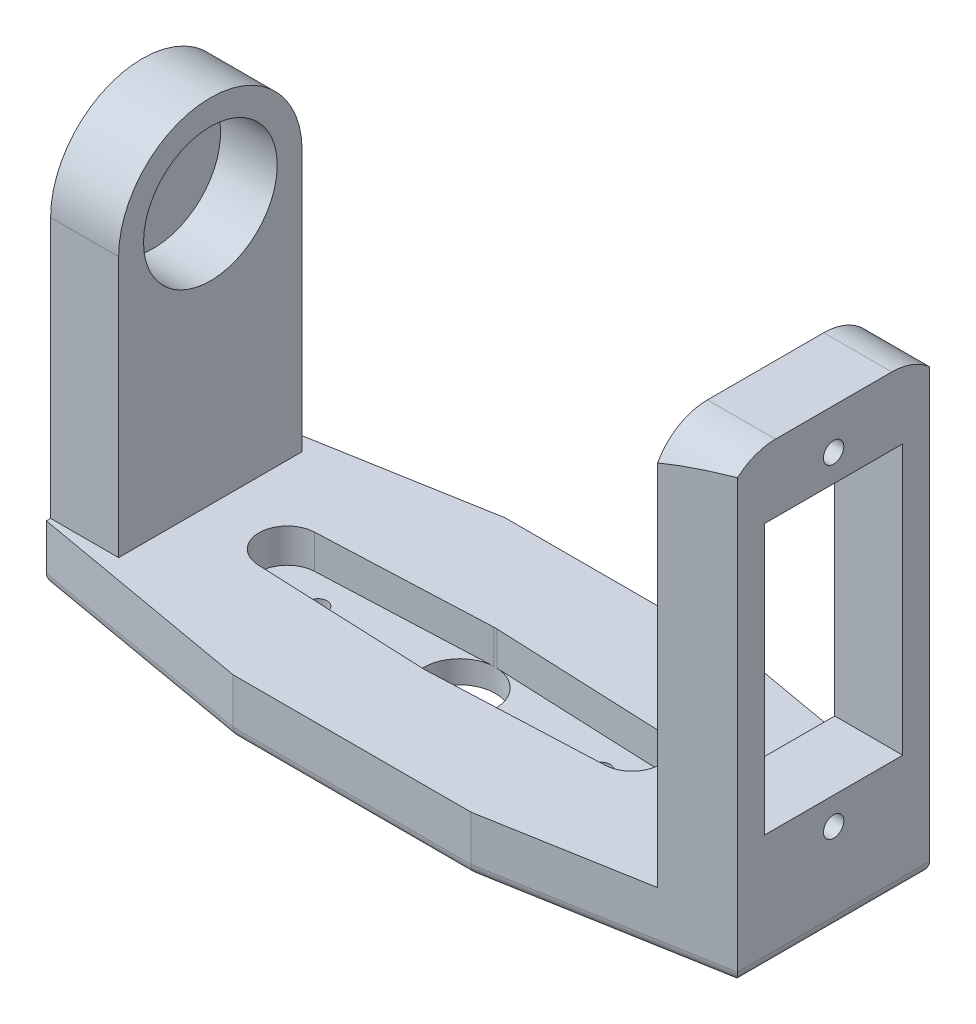
from build123d import *

# Parameters (mm, degrees)
SKETCH_1_W          = 61
SKETCH_1_H          = 24
EXTRUDE_1_DEPTH     = 5
SKETCH_2_W          = 16.198202564
SKETCH_2_H          = 31.099101282
SKETCH_2_R          = 5.9
EXTRUDE_2_DEPTH     = 6
SKETCH_8_R          = 5.9
EXTRUDE_4_DEPTH     = 1
FILLET_1_RADIUS     = 8.099101282
FILLET_1_LENGTH     = 6
SKETCH_3_W          = 20.26798367
SKETCH_3_H          = 35.075185683
SKETCH_3_R          = 0.9
SKETCH_3_W_2        = 12.2
SKETCH_3_H_2        = 23.8
EXTRUDE_3_DEPTH     = 6
FILLET_2_R          = 5
CHAMFER_1_SIZE      = 3.526539614
CHAMFER_1_SIZE_2    = 20
FILLET_4_R          = 1
CUT_EXTRUDE_1_DEPTH = 3
SKETCH_5_R          = 3.15
SKETCH_5_R_2        = 0.8
CUT_EXTRUDE_2_DEPTH = 2.4


with BuildPart() as part:
    # 草图1 → 凸台-拉伸1 (new body)
    with BuildSketch(Plane(origin=(0, 0, 0), x_dir=(1, 0, 0), z_dir=(0, 1, 0))):
        with Locations((2.5, 0)):
            Rectangle(SKETCH_1_W, SKETCH_1_H)
    extrude(amount=EXTRUDE_1_DEPTH)

    # 草图2 → 凸台-拉伸2 (add)
    with BuildSketch(Plane.ZY.offset(28)):
        with Locations((0, 20.549550641)):
            Rectangle(SKETCH_2_W, SKETCH_2_H)
        with Locations((0, 28)):
            Circle(SKETCH_2_R, mode=Mode.SUBTRACT)
    extrude(amount=-EXTRUDE_2_DEPTH)

    # 草图8 → 凸台-拉伸4 (add)
    with BuildSketch(Plane.ZY.offset(28)):
        with Locations((0, 28)):
            Circle(SKETCH_8_R)
    extrude(amount=-EXTRUDE_4_DEPTH)

    # 圆角1: full round fillet: the end face becomes a half cylinder, R = half its width
    fillet_1_face = Plane((-25, 36.099101282, 0), x_dir=(-1, 0, 0), z_dir=(0, 1, 0))  # on the end face: x along it, z out of the body
    fillet_1_slab = fillet_1_face.offset(-FILLET_1_RADIUS / 2) * Box(FILLET_1_LENGTH, 2 * FILLET_1_RADIUS, FILLET_1_RADIUS, mode=Mode.PRIVATE)  # the body's end, R deep
    fillet_1_round = Plane((-25, 28, 0), x_dir=(0, 1, 0), z_dir=(-1, 0, 0)) * Cylinder(FILLET_1_RADIUS, FILLET_1_LENGTH, mode=Mode.PRIVATE)  # its axis R under the face
    add(fillet_1_slab - fillet_1_round, mode=Mode.SUBTRACT)

    # 草图3 → 凸台-拉伸3 (add)
    with BuildSketch(Plane(origin=(33, 0, 0), x_dir=(0, 0, -1), z_dir=(1, 0, 0))):
        with Locations((0, 22.537592842)):
            Rectangle(SKETCH_3_W, SKETCH_3_H)
        with Locations((0, 7.9)):
            Circle(SKETCH_3_R, mode=Mode.SUBTRACT)
        with Locations(Location((0, 36.5, 0), (0, 0, 180))):
            Circle(SKETCH_3_R, mode=Mode.SUBTRACT)
        with Locations((0, 22.2)):
            Rectangle(SKETCH_3_W_2, SKETCH_3_H_2, mode=Mode.SUBTRACT)
    extrude(amount=-EXTRUDE_3_DEPTH)

    # 圆角2
    fillet_2_edges = [part.edges().sort_by_distance(p)[0] for p in [
        (30, 40.075185683, 10.133991835),
        (30, 40.075185683, -10.133991835),
    ]]
    fillet(fillet_2_edges, radius=FILLET_2_R)

    # 倒角1
    # the kernel refuses this chamfer: 20, 3.526539614 mm, written as the material it takes off along each edge
    with BuildSketch(Plane(origin=(33, -51.970775928, -12), x_dir=(0.21013876076743143, 0, 0.9776715712462587), z_dir=(0, 1, 0))) as chamfer_1_piece_1:
        Polygon((CHAMFER_1_SIZE * 0.977671571293, -CHAMFER_1_SIZE * 0.210138760778), (-CHAMFER_1_SIZE_2 * 0.210138760767, -CHAMFER_1_SIZE_2 * 0.977671571246), (0, 0), align=None)
    extrude(amount=108.941551857, mode=Mode.SUBTRACT)
    with BuildSketch(Plane(origin=(-28, -51.970775928, -12), x_dir=(0.9999776716360547, 0, -0.006682531656102014), z_dir=(0, 1, 0))) as chamfer_1_piece_2:
        Polygon((CHAMFER_1_SIZE_2 * 0.999977671636, -CHAMFER_1_SIZE_2 * 0.0066825316561), (-CHAMFER_1_SIZE * 0.00668253165642, -CHAMFER_1_SIZE * 0.999977671684), (0, 0), align=None)
    extrude(amount=108.941551857, mode=Mode.SUBTRACT)
    with BuildSketch(Plane(origin=(33, -51.970775928, 12), x_dir=(0.21013876076743124, 0, -0.9776715712462587), z_dir=(0, 1, 0))) as chamfer_1_piece_3:
        Polygon((CHAMFER_1_SIZE * 0.977671571293, CHAMFER_1_SIZE * 0.210138760778), (-CHAMFER_1_SIZE_2 * 0.210138760767, CHAMFER_1_SIZE_2 * 0.977671571246), (0, 0), align=None)
    extrude(amount=108.941551857, mode=Mode.SUBTRACT)
    with BuildSketch(Plane(origin=(-28, -51.970775928, 12), x_dir=(0.9999776716360547, 0, 0.006682531656101331), z_dir=(0, 1, 0))) as chamfer_1_piece_4:
        Polygon((CHAMFER_1_SIZE_2 * 0.999977671636, CHAMFER_1_SIZE_2 * 0.0066825316561), (-CHAMFER_1_SIZE * 0.00668253165642, CHAMFER_1_SIZE * 0.999977671684), (0, 0), align=None)
    extrude(amount=108.941551857, mode=Mode.SUBTRACT)

    # 圆角4
    fillet_4_edges = [part.edges().sort_by_distance(p)[0] for p in [
        (2.5, 0, -12),
        (-28, 0, 0),
        (33, 0, 0),
        (2.5, 0, 12),
        (-18, 0, -10.236730193),
        (-18, 0, 10.236730193),
        (23, 0, 10.236730193),
        (23, 0, -10.236730193),
    ]]
    fillet(fillet_4_edges, radius=FILLET_4_R)

    # 草图4 → 切除-拉伸1 (cut)
    with BuildSketch(Plane(origin=(-24, 5, 6), x_dir=(-1, 0, 0), z_dir=(0, -1, 0))):
        with BuildLine():
            Line((-23.865345259, 9.147120605), (-8.68757668, 8.497714766))
            ThreePointArc((-8.68757668, 8.497714766), (-6.294445522, 6), (-8.68757668, 3.502285234))
            Line((-8.68757668, 3.502285234), (-23.865345259, 2.852879395))
            ThreePointArc((-23.865345259, 2.852879395), (-27.15, 6), (-23.865345259, 9.147120605))
        make_face()
    cut_extrude_1 = extrude(amount=CUT_EXTRUDE_1_DEPTH, mode=Mode.SUBTRACT)

    # 镜向1: 切除-拉伸1 across plane
    add(cut_extrude_1.mirror(Plane(origin=(0, 0, 0), x_dir=(0, 0, 1), z_dir=(1, 0, 0))), mode=Mode.SUBTRACT)

    # 草图5 → 切除-拉伸2 (cut)
    with BuildSketch(Plane(origin=(0, 2, 0), x_dir=(1, 0, 0), z_dir=(0, 1, 0))):
        with Locations(Location((0, 0, 0), (0, 0, 270))):
            Circle(SKETCH_5_R)
        with Locations(Location((-12.5, 0, 0), (0, 0, 270))):
            Circle(SKETCH_5_R_2)
        with Locations(Location((12.5, 0, 0), (0, 0, 270))):
            Circle(SKETCH_5_R_2)
    extrude(amount=-CUT_EXTRUDE_2_DEPTH, mode=Mode.SUBTRACT)


solid = part.part
